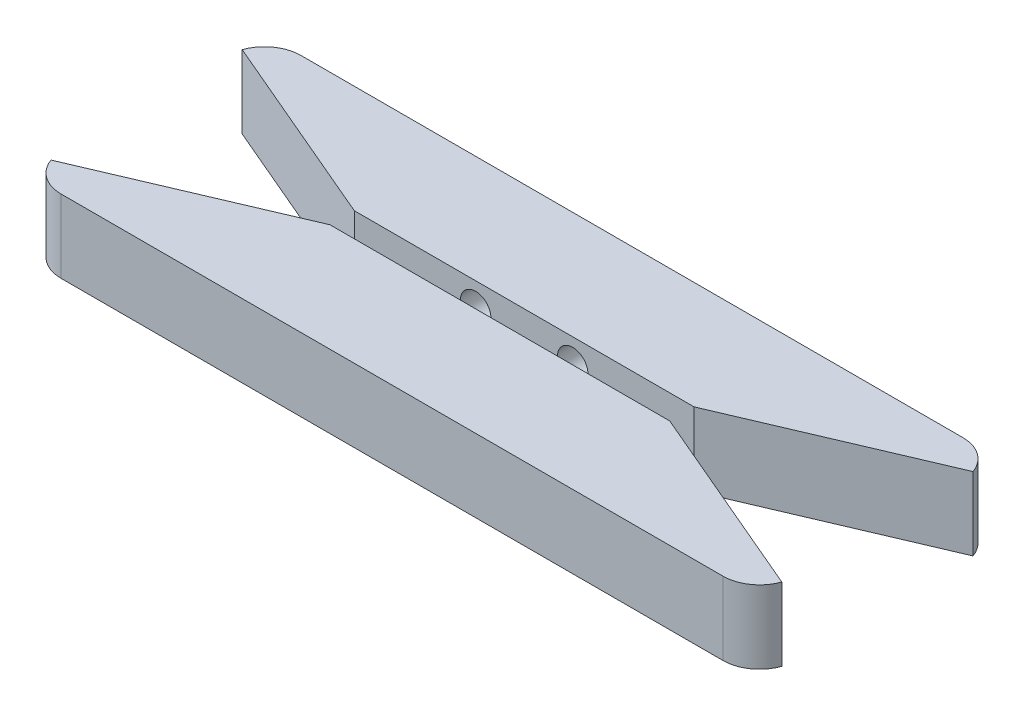
from build123d import *

# Parameters (mm, degrees)
BOSS_EXTRUDE1_DEPTH = 12
SKETCH3_R           = 2.5
CUT_EXTRUDE1_DEPTH  = 8.5
FILLET1_R           = 6


with BuildPart() as part:
    # Sketch1 → Boss-Extrude1 (new body)
    with BuildSketch(Plane(origin=(0, 0, 0), x_dir=(1, 0, 0), z_dir=(0, 1, 0))):
        Polygon((-60, 17.7), (60, 17.7), (60, 13.7), (27.895, 0), (-27.895, 0), (-60, 13.7), align=None)
    extrude(amount=BOSS_EXTRUDE1_DEPTH)

    # Sketch3 → Cut-Extrude1 (cut)
    with BuildSketch(Plane.XY):
        with Locations((-7.97, 8)):
            Circle(SKETCH3_R)
        with Locations(Location((7.97, 8, 0), (0, 0, 180))):
            Circle(SKETCH3_R)
    extrude(amount=-CUT_EXTRUDE1_DEPTH, mode=Mode.SUBTRACT)

    # Fillet1
    # the kernel refuses this fillet: 6 mm, written as the material it takes off along each edge
    with BuildSketch(Plane(origin=(60, -14.142135624, -17.7), x_dir=(-1, 0, 0), z_dir=(0, 1, 0))) as fillet1_piece_1:
        with BuildLine():
            CenterArc((5.656854249, 6), FILLET1_R, 199.471220634, 70.528779366)
            Line((0, 4), (-0.113137085, 3.96))
            ThreePointArc((-0.113137085, 3.96), (-0.12, 2), (-0.12, 0))
            Line((-0.12, 0), (0, -0.12))
            Line((0, -0.12), (5.656854249, -0.12))
            Line((5.656854249, -0.12), (5.656854249, 0))
        make_face()
    extrude(amount=40.284271247, mode=Mode.SUBTRACT)
    with BuildSketch(Plane(origin=(-60, -14.142135624, -17.7), x_dir=(1, 0, 0), z_dir=(0, 1, 0))) as fillet1_piece_2:
        with BuildLine():
            CenterArc((5.656854249, -6), FILLET1_R, 90, 70.528779366)
            Line((0, -4), (-0.113137085, -3.96))
            ThreePointArc((-0.113137085, -3.96), (-0.12, -2), (-0.12, 0))
            Line((-0.12, 0), (0, 0.12))
            Line((0, 0.12), (5.656854249, 0.12))
            Line((5.656854249, 0.12), (5.656854249, 0))
        make_face()
    extrude(amount=40.284271247, mode=Mode.SUBTRACT)


with BuildPart() as body_2:
    # Mirror2: mirrored copy
    add(part.part.mirror(Plane.XY.offset(2)))


solid = Compound([part.part, body_2.part])
